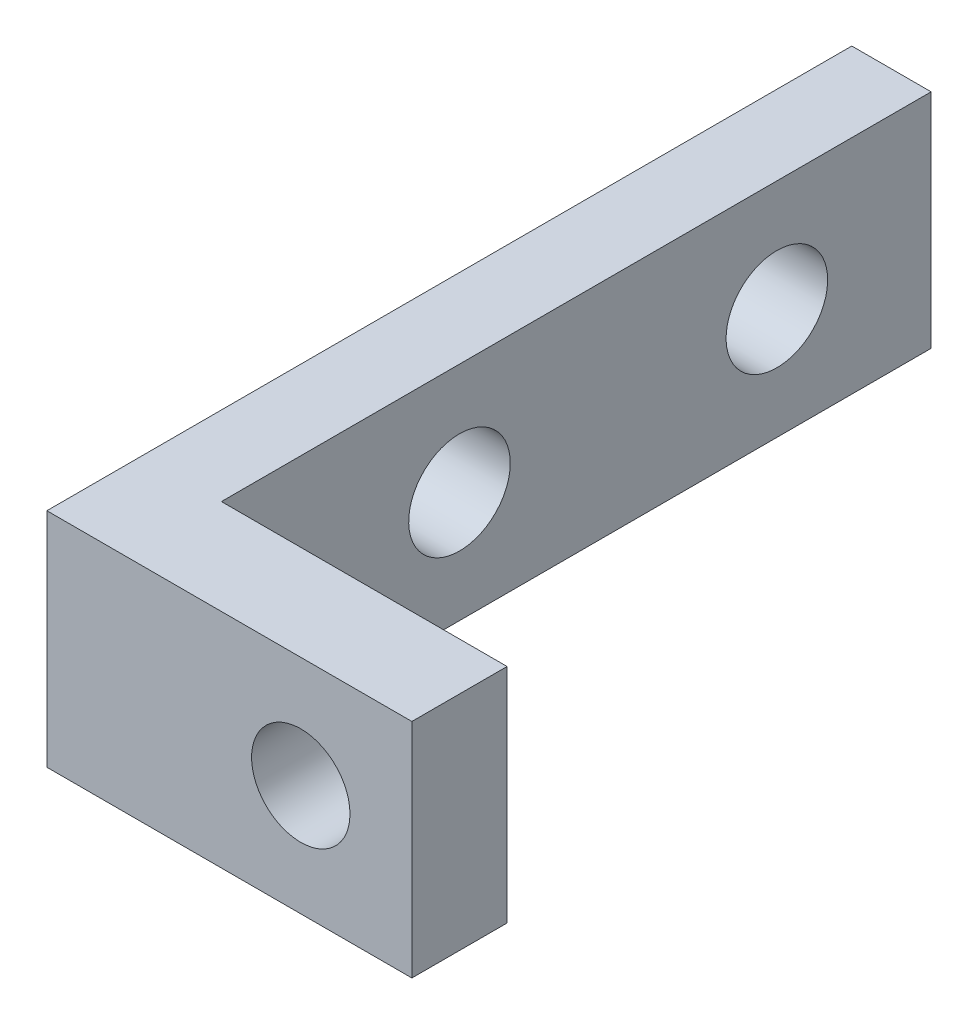
from build123d import *

# Parameters (mm, degrees)
SKETCH1_W           = 132
SKETCH1_H           = 160
BOSS_EXTRUDE1_DEPTH = 6
SKETCH3_W           = 32
SKETCH3_H           = 54
SKETCH3_W_2         = 26
SKETCH3_H_2         = 48
BOSS_EXTRUDE2_DEPTH = 17.5
SKETCH4_W           = 32
SKETCH4_H           = 54
BOSS_EXTRUDE3_DEPTH = 3
SKETCH5_W           = 25
SKETCH5_H           = 17
CUT_EXTRUDE1_DEPTH  = 3
SKETCH6_W           = 12
SKETCH6_H           = 54
BOSS_EXTRUDE4_DEPTH = 3
SKETCH7_R           = 1.6
CUT_EXTRUDE2_DEPTH  = 106.177231376
SKETCH8_W           = 3
SKETCH8_H           = 6.5
BOSS_EXTRUDE5_DEPTH = 20
SKETCH9_R           = 1.55
CUT_EXTRUDE3_DEPTH  = 6
SKETCH10_R          = 1.6
CUT_EXTRUDE4_DEPTH  = 108.043215572
SKETCH11_W          = 2.5
SKETCH11_H          = 7
BOSS_EXTRUDE6_DEPTH = 19.36
SKETCH12_R          = 1.6
CUT_EXTRUDE5_DEPTH  = 19.36
SKETCH13_W          = 3
SKETCH13_H          = 7
BOSS_EXTRUDE7_DEPTH = 15
SKETCH14_R          = 2
CUT_EXTRUDE6_DEPTH  = 15
CUT_EXTRUDE7_START  = -6
CUT_EXTRUDE7_DEPTH  = 6
SKETCH16_R          = 1.6
CUT_EXTRUDE8_DEPTH  = 15
SKETCH17_W          = 117.76
SKETCH17_H          = 77.767250212
CUT_EXTRUDE9_DEPTH  = 109
SKETCH18_R          = 1.55
CUT_EXTRUDE10_DEPTH = 109
SKETCH18_3_W        = 9
SKETCH18_3_H        = 7
CUT_EXTRUDE11_DEPTH = 3
SKETCH19_W          = 47.5
SKETCH19_H          = 6
CUT_EXTRUDE12_DEPTH = 80
SKETCH19_3_W        = 2.7
SKETCH19_3_H        = 6
CUT_EXTRUDE13_DEPTH = 80
SKETCH19_4_W        = 9
SKETCH19_4_H        = 3
CUT_EXTRUDE14_DEPTH = 80
SKETCH20_W          = 62.599740271
SKETCH20_H          = 63.599226712
CUT_EXTRUDE15_DEPTH = 80


# Read off the part's stored shape, not the designer's step: Cut-Extrude7
with BuildPart() as part:
    # Sketch1 → Boss-Extrude1 (new body)
    with BuildSketch(Plane.XY):
        Rectangle(SKETCH1_W, SKETCH1_H)
    extrude(amount=BOSS_EXTRUDE1_DEPTH)

    # Sketch3 → Boss-Extrude2 (add)
    with BuildSketch(Plane.XY.offset(6)):
        with Locations((0, -53)):
            Rectangle(SKETCH3_W, SKETCH3_H)
        with Locations((0, -53)):
            Rectangle(SKETCH3_W_2, SKETCH3_H_2, mode=Mode.SUBTRACT)
    extrude(amount=BOSS_EXTRUDE2_DEPTH)

    # Sketch4 → Boss-Extrude3 (add)
    with BuildSketch(Plane.XY.offset(23.5)):
        with Locations((0, -53)):
            Rectangle(SKETCH4_W, SKETCH4_H)
    extrude(amount=BOSS_EXTRUDE3_DEPTH)

    # Sketch5 → Cut-Extrude1 (cut)
    with BuildSketch(Plane.XZ.offset(80)):
        with Locations((0, 14.5)):
            Rectangle(SKETCH5_W, SKETCH5_H)
    extrude(amount=-CUT_EXTRUDE1_DEPTH, mode=Mode.SUBTRACT)

    # Sketch6 → Boss-Extrude4 (add)
    with BuildSketch(Plane.XY.offset(6)):
        with Locations((-22, -53)):
            Rectangle(SKETCH6_W, SKETCH6_H)
        with Locations((22, -53)):
            Rectangle(SKETCH6_W, SKETCH6_H)
    extrude(amount=BOSS_EXTRUDE4_DEPTH)

    # Sketch7 → Cut-Extrude2 (cut, through all)
    with BuildSketch(Plane.XY.offset(9)):
        with Locations((-22, -69)):
            Circle(SKETCH7_R)
        with Locations((-22, -33)):
            Circle(SKETCH7_R)
        with Locations(Location((22, -69, 0), (0, 0, 180))):
            Circle(SKETCH7_R)
        with Locations(Location((22, -33, 0), (0, 0, 180))):
            Circle(SKETCH7_R)
    extrude(amount=-CUT_EXTRUDE2_DEPTH, mode=Mode.SUBTRACT)

    # Sketch8 → Boss-Extrude5 (add)
    with BuildSketch(Plane.XY.offset(6)):
        with Locations((-54.38, -76.75)):
            Rectangle(SKETCH8_W, SKETCH8_H)
        with Locations((-54.38, -30.25)):
            Rectangle(SKETCH8_W, SKETCH8_H)
    boss_extrude5 = extrude(amount=BOSS_EXTRUDE5_DEPTH)

    # Sketch9 → Cut-Extrude3 (cut)
    with BuildSketch(Plane.ZY.offset(55.88)):
        with Locations((10.35, -76.75)):
            Circle(SKETCH9_R)
        with Locations((19.65, -76.75)):
            Circle(SKETCH9_R)
        with Locations((10.35, -30.25)):
            Circle(SKETCH9_R)
        with Locations((19.65, -30.25)):
            Circle(SKETCH9_R)
    cut_extrude3 = extrude(amount=-CUT_EXTRUDE3_DEPTH, mode=Mode.SUBTRACT)

    # Mirror1: Boss-Extrude5, Cut-Extrude3 across plane
    add(boss_extrude5.mirror(Plane(origin=(0, 0, 0), x_dir=(0, 0, 1), z_dir=(1, 0, 0))))
    add(cut_extrude3.mirror(Plane(origin=(0, 0, 0), x_dir=(0, 0, 1), z_dir=(1, 0, 0))), mode=Mode.SUBTRACT)

    # Sketch10 → Cut-Extrude4 (cut, through all)
    with BuildSketch(Plane(origin=(0, 0, 0), x_dir=(-1, 0, 0), z_dir=(0, 0, -1))):
        with Locations((-24.1, -75.572749788)):
            Circle(SKETCH10_R)
        with Locations((-21.15, -12.732749788)):
            Circle(SKETCH10_R)
        with Locations(Location((21.15, -12.732749788, 0), (0, 0, 180))):
            Circle(SKETCH10_R)
        with Locations((24.1, -75.572749788)):
            Circle(SKETCH10_R)
    extrude(amount=-CUT_EXTRUDE4_DEPTH, mode=Mode.SUBTRACT)

    # Sketch11 → Boss-Extrude6 (add)
    with BuildSketch(Plane(origin=(0, 0, 0), x_dir=(-1, 0, 0), z_dir=(0, 0, -1))):
        with Locations((-17.9, 1.267250212)):
            Rectangle(SKETCH11_W, SKETCH11_H)
        with Locations((-17.9, 50.267250212)):
            Rectangle(SKETCH11_W, SKETCH11_H)
    extrude(amount=BOSS_EXTRUDE6_DEPTH)

    # Sketch12 → Cut-Extrude5 (cut)
    with BuildSketch(Plane(origin=(19.15, 0, 0), x_dir=(0, 0, -1), z_dir=(1, 0, 0))):
        with Locations(Location((4.5, 50.267250212, 0), (0, 0, 90))):
            Circle(SKETCH12_R)
        with Locations(Location((14.5, 50.267250212, 0), (0, 0, 90))):
            Circle(SKETCH12_R)
        with Locations(Location((4.5, 1.267250212, 0), (0, 0, 90))):
            Circle(SKETCH12_R)
        with Locations(Location((14.5, 1.267250212, 0), (0, 0, 90))):
            Circle(SKETCH12_R)
    extrude(amount=-CUT_EXTRUDE5_DEPTH, mode=Mode.SUBTRACT)

    # Sketch13 → Boss-Extrude7 (add)
    with BuildSketch(Plane(origin=(0, 0, 0), x_dir=(-1, 0, 0), z_dir=(0, 0, -1))):
        with Locations((29.35, 35.967250212)):
            Rectangle(SKETCH13_W, SKETCH13_H)
    extrude(amount=BOSS_EXTRUDE7_DEPTH)

    # Sketch14 → Cut-Extrude6 (cut)
    with BuildSketch(Plane.ZY.offset(30.85)):
        with Locations((-9.9, 35.967250212)):
            Circle(SKETCH14_R)
    extrude(amount=-CUT_EXTRUDE6_DEPTH, mode=Mode.SUBTRACT)

    # Cut-Extrude7 outline → Cut-Extrude7 (cut)
    with BuildSketch(Plane(origin=(0, 0, 0), x_dir=(-1, 0, 0), z_dir=(0, 0, -1)).offset(CUT_EXTRUDE7_START)):
        Polygon((-30.85, 56.767250212), (30.85, 56.767250212), (30.85, -24), (58.88, -24), (58.88, -80), (66, -80), (66, 80), (-66, 80), (-66, -80), (-58.88, -80), (-58.88, -24), (-30.85, -24), align=None)
    extrude(amount=CUT_EXTRUDE7_DEPTH, mode=Mode.SUBTRACT)

    # Sketch16 → Cut-Extrude8 (cut)
    with BuildSketch(Plane(origin=(0, 0, 0), x_dir=(-1, 0, 0), z_dir=(0, 0, -1))):
        Circle(SKETCH16_R)
        with Locations((0, 52.767250212)):
            Circle(SKETCH16_R)
    extrude(amount=-CUT_EXTRUDE8_DEPTH, mode=Mode.SUBTRACT)

    # Sketch17 → Cut-Extrude9 (cut)
    with BuildSketch(Plane(origin=(0, 0, 0), x_dir=(-1, 0, 0), z_dir=(0, 0, -1))):
        with Locations((0, -41.116374894)):
            Rectangle(SKETCH17_W, SKETCH17_H)
    extrude(amount=-CUT_EXTRUDE9_DEPTH, mode=Mode.SUBTRACT)

    # Sketch18 → Cut-Extrude10 (cut)
    with BuildSketch(Plane(origin=(0, 0, 0), x_dir=(-1, 0, 0), z_dir=(0, 0, -1))):
        with Locations((-24.65, 1.267250212)):
            Circle(SKETCH18_R)
    extrude(amount=-CUT_EXTRUDE10_DEPTH, mode=Mode.SUBTRACT)

    # Sketch18<3> → Cut-Extrude11 (cut)
    with BuildSketch(Plane(origin=(0, 0, 0), x_dir=(-1, 0, 0), z_dir=(0, 0, -1))):
        with Locations((-23.65, 1.267250212)):
            Rectangle(SKETCH18_3_W, SKETCH18_3_H)
    extrude(amount=-CUT_EXTRUDE11_DEPTH, mode=Mode.SUBTRACT)

    # Sketch19 → Cut-Extrude12 (cut)
    with BuildSketch(Plane.XZ.offset(2.232749788)):
        with Locations((-7.1, 3)):
            Rectangle(SKETCH19_W, SKETCH19_H)
    extrude(amount=-CUT_EXTRUDE12_DEPTH, mode=Mode.SUBTRACT)


with BuildPart() as body_2:
    # of the pieces the cut leaves, the one that is kept (cut_extrude12_keep)
    add(part.part.solids().sort_by_distance((30.85, -2.232749788, 0))[0])

    # Sketch19<3> → Cut-Extrude13 (cut)
    with BuildSketch(Plane.XZ.offset(2.232749788)):
        with Locations((29.5, 3)):
            Rectangle(SKETCH19_3_W, SKETCH19_3_H)
    extrude(amount=-CUT_EXTRUDE13_DEPTH, mode=Mode.SUBTRACT)

    # Sketch19<4> → Cut-Extrude14 (cut)
    with BuildSketch(Plane.XZ.offset(2.232749788)):
        with Locations((23.65, 1.5)):
            Rectangle(SKETCH19_4_W, SKETCH19_4_H)
    extrude(amount=-CUT_EXTRUDE14_DEPTH, mode=Mode.SUBTRACT)

    # Sketch20 → Cut-Extrude15 (cut)
    with BuildSketch(Plane(origin=(0, 0, 0), x_dir=(-1, 0, 0), z_dir=(0, 0, -1))):
        with Locations((-47.949870136, 36.566863568)):
            Rectangle(SKETCH20_W, SKETCH20_H)
    extrude(amount=-CUT_EXTRUDE15_DEPTH, mode=Mode.SUBTRACT)


with BuildPart() as body_2_2:
    # of the pieces the cut leaves, the one that is kept (cut_extrude15_keep)
    add(body_2.part.solids().sort_by_distance((16.65, -2.232749788, -19.36))[0])


solid = body_2_2.part
